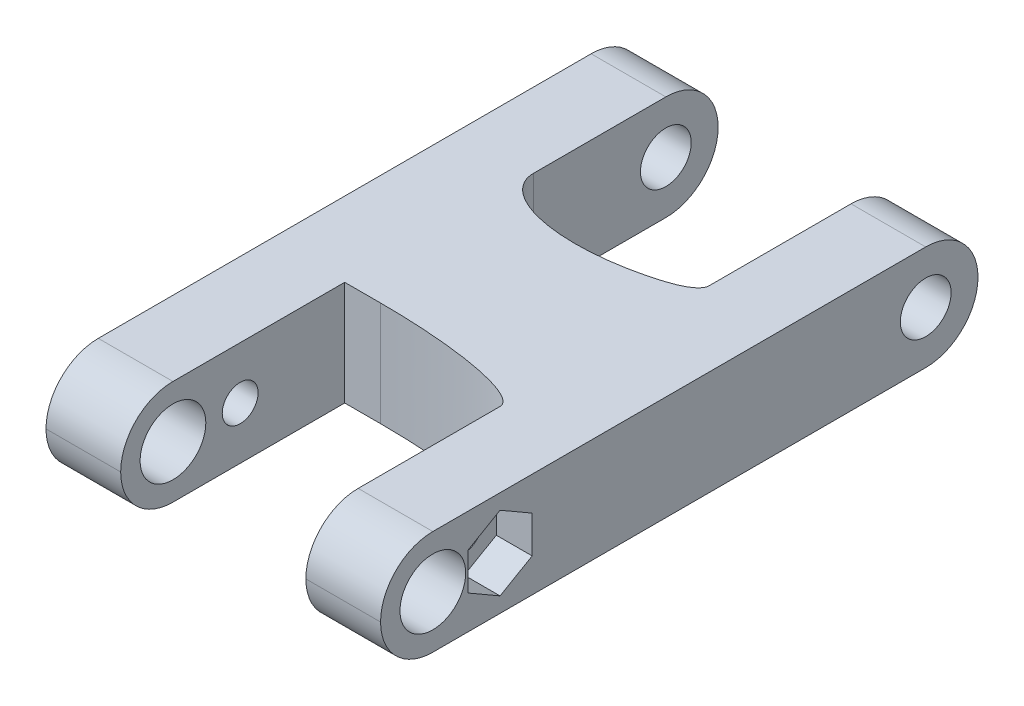
from build123d import *

# Parameters (mm, degrees)
BOSS_EXTRUDE1_DEPTH = 7
FILLET1_R           = 3.5
SKETCH2_R           = 2.2
SKETCH2_R_2         = 1.7
CUT_EXTRUDE1_DEPTH  = 47.376287044
FILLET2_SIZE        = 8
FILLET2_SIZE_2      = 2
FILLET3_START       = -1
FILLET3_DEPTH       = 9
FILLET3_2_DEPTH     = 7
SKETCH3_R           = 1.2
CUT_EXTRUDE2_DEPTH  = 47.376287108
SKETCH4_R           = 1.85
CUT_EXTRUDE3_DEPTH  = 2.4
CUT_EXTRUDE4_DEPTH  = 2.4


with BuildPart() as part:
    # Sketch1 → Boss-Extrude1 (new body)
    with BuildSketch(Plane(origin=(0, 0, 0), x_dir=(1, 0, 0), z_dir=(0, 1, 0))):
        Polygon((0, 0), (0, 40), (5, 40), (5, 25), (17.4, 25), (17.4, 40), (22.4, 40), (22.4, 0), (17.4, 0), (17.4, 15), (5, 15), (5, 0), align=None)
    extrude(amount=BOSS_EXTRUDE1_DEPTH)

    # Fillet1
    fillet1_edges = [part.edges().sort_by_distance(p)[0] for p in [
        (2.5, 0, -40),
        (2.5, 7, -40),
        (19.9, 0, -40),
        (19.9, 7, -40),
        (2.5, 0, 0),
        (2.5, 7, 0),
        (19.9, 0, 0),
        (19.9, 7, 0),
    ]]
    fillet(fillet1_edges, radius=FILLET1_R - 0.0001)  # a hair under: the kernel refuses the full size

    # Sketch2 → Cut-Extrude1 (cut, through all)
    with BuildSketch(Plane(origin=(22.4, 0, 0), x_dir=(0, 0, -1), z_dir=(1, 0, 0))):
        with Locations((3.5, 3.5)):
            Circle(SKETCH2_R)
        with Locations((36.5, 3.5)):
            Circle(SKETCH2_R_2)
    extrude(amount=-CUT_EXTRUDE1_DEPTH, mode=Mode.SUBTRACT)

    # Fillet2
    # a fillet whose section is not a circle: 8, 2 mm, written as the material it adds along each edge
    with BuildSketch(Plane(origin=(17.4, 0, -25), x_dir=(-1, 0, 0), z_dir=(0, 1, 0))) as fillet2_piece_1:
        with BuildLine():
            Bezier((FILLET2_SIZE, 0), (0, 0), (0, -FILLET2_SIZE_2), weights=[1, 0.707106781, 1])
            Line((0, -FILLET2_SIZE_2), (0, 0))
            Line((0, 0), (FILLET2_SIZE, 0))
        make_face()
    extrude(amount=7)

    # Fillet3: read off the stored shape, not the designer's step
    # Fillet3 outline → Fillet3 (cut)
    with BuildSketch(Plane(origin=(0, 0, 0), x_dir=(1.0, 3.4671016661374288e-12, 0), z_dir=(-3.4671016661374288e-12, 1.0, 2.5010475807975105e-12)).offset(FILLET3_START)):
        with BuildLine():
            add(Edge.make_bspline(
                [(15.582462981, 25.730719902), (12.297568617, 24.730707285), (9.28088208, 25)],
                knots=[0, 0, 0, 0.430571461, 0.430571461, 0.430571461], degree=2, weights=[1, 0.825748512, 0.80155246]))
            add(Edge.make_bspline(
                [(15.582462981, 25.730719902), (13.182155578, 25), (9.4, 25)],
                knots=[0.440891805, 0.440891805, 0.440891805, 1, 1, 1], degree=2, weights=[0.855599999, 0.836241001, 1]))
            Line((9.4, 25), (9.28088208, 25))
        make_face()
    extrude(amount=FILLET3_DEPTH, mode=Mode.SUBTRACT)

    # Fillet3 2 outline → Fillet3 2 (add)
    with BuildSketch(Plane(origin=(0, 0, 0), x_dir=(1.0, 3.4671016661374288e-12, 0), z_dir=(-3.4671016661374288e-12, 1.0, 2.5010475807975105e-12))):
        with BuildLine():
            Line((5, 25), (9.28088208, 25))
            add(Edge.make_bspline(
                [(9.28088208, 25), (5, 25.382144563), (5, 27.644025125)],
                knots=[0.430571461, 0.430571461, 0.430571461, 1, 1, 1], degree=2, weights=[0.80155246, 0.769553306, 1]))
            Line((5, 27.644025125), (5, 25))
        make_face()
        with BuildLine():
            Line((17.4, 15), (7.4, 15))
            add(Edge.make_bspline(
                [(7.4, 15), (17.4, 15), (17.4, 13)],
                knots=[0, 0, 0, 1, 1, 1], degree=2, weights=[1, 0.707106781, 1]))
            Line((17.4, 13), (17.4, 15))
        make_face()
    extrude(amount=FILLET3_2_DEPTH)

    # Sketch3 → Cut-Extrude2 (cut, through all)
    with BuildSketch(Plane.ZY):
        with Locations((-8, 3.5)):
            Circle(SKETCH3_R)
    extrude(amount=-CUT_EXTRUDE2_DEPTH, mode=Mode.SUBTRACT)

    # Sketch4 → Cut-Extrude3 (cut)
    with BuildSketch(Plane.ZY):
        with Locations((-8, 3.5)):
            Circle(SKETCH4_R)
    extrude(amount=-CUT_EXTRUDE3_DEPTH, mode=Mode.SUBTRACT)

    # Sketch5 → Cut-Extrude4 (cut)
    with BuildSketch(Plane(origin=(22.4, 0, 0), x_dir=(0, 0, -1), z_dir=(1, 0, 0))):
        Polygon((10.15, 4.741303079), (8, 5.982606158), (5.85, 4.741303079), (5.85, 2.258696921), (8, 1.017393842), (10.15, 2.258696921), align=None)
    extrude(amount=-CUT_EXTRUDE4_DEPTH, mode=Mode.SUBTRACT)


solid = part.part
